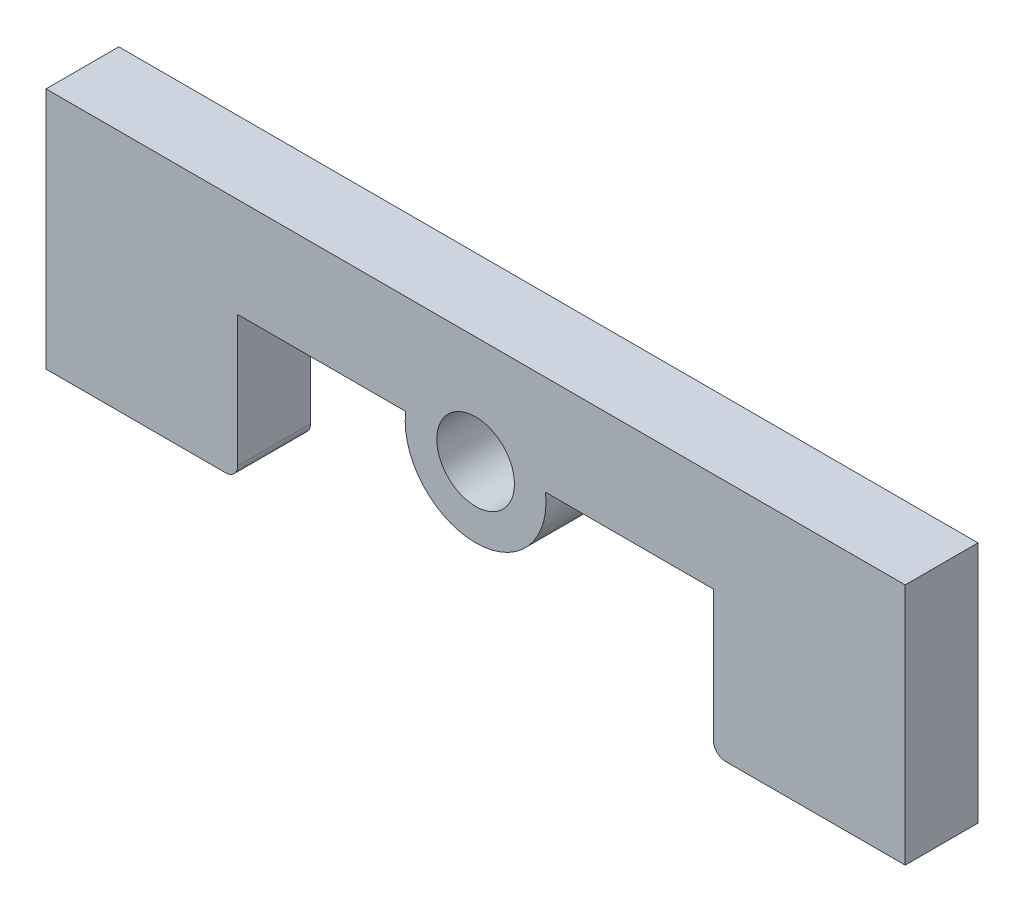
from build123d import *

# Parameters (mm, degrees)
SKETCH2_R           = 1.6
BOSS_EXTRUDE2_DEPTH = 3
FILLET1_R           = 2.5
FILLET2_R           = 0.5


with BuildPart() as part:
    # Sketch2 → Boss-Extrude2 (new body)
    with BuildSketch(Plane.XY):
        with BuildLine():
            Line((9.8, 0.9), (9.8, -5))
            Line((9.8, -5), (17.7, -5))
            Line((17.7, -5), (17.7, 5))
            Line((17.7, 5), (-17.7, 5))
            Line((-17.7, 5), (-17.7, -5))
            Line((-17.7, -5), (-9.8, -5))
            Line((-9.8, -5), (-9.8, 0.9))
            Line((-9.8, 0.9), (-2.878801834, 0.9))
            ThreePointArc((-2.878801834, 0.9), (0, -2.35), (2.878801834, 0.9))
            Line((2.878801834, 0.9), (9.8, 0.9))
        make_face()
        with Locations((0, 0.55)):
            Circle(SKETCH2_R, mode=Mode.SUBTRACT)
    extrude(amount=BOSS_EXTRUDE2_DEPTH)

    # Fillet1
    fillet1_edges = [part.edges().sort_by_distance(p)[0] for p in [
        (-6.339400917, 0.9, 0),
        (6.339400917, 0.9, 0),
    ]]
    fillet(fillet1_edges, radius=FILLET1_R)

    # Fillet2
    fillet2_edges = [part.edges().sort_by_distance(p)[0] for p in [
        (9.8, -5, 1.5),
        (-9.8, -5, 1.5),
    ]]
    fillet(fillet2_edges, radius=FILLET2_R)


solid = part.part
